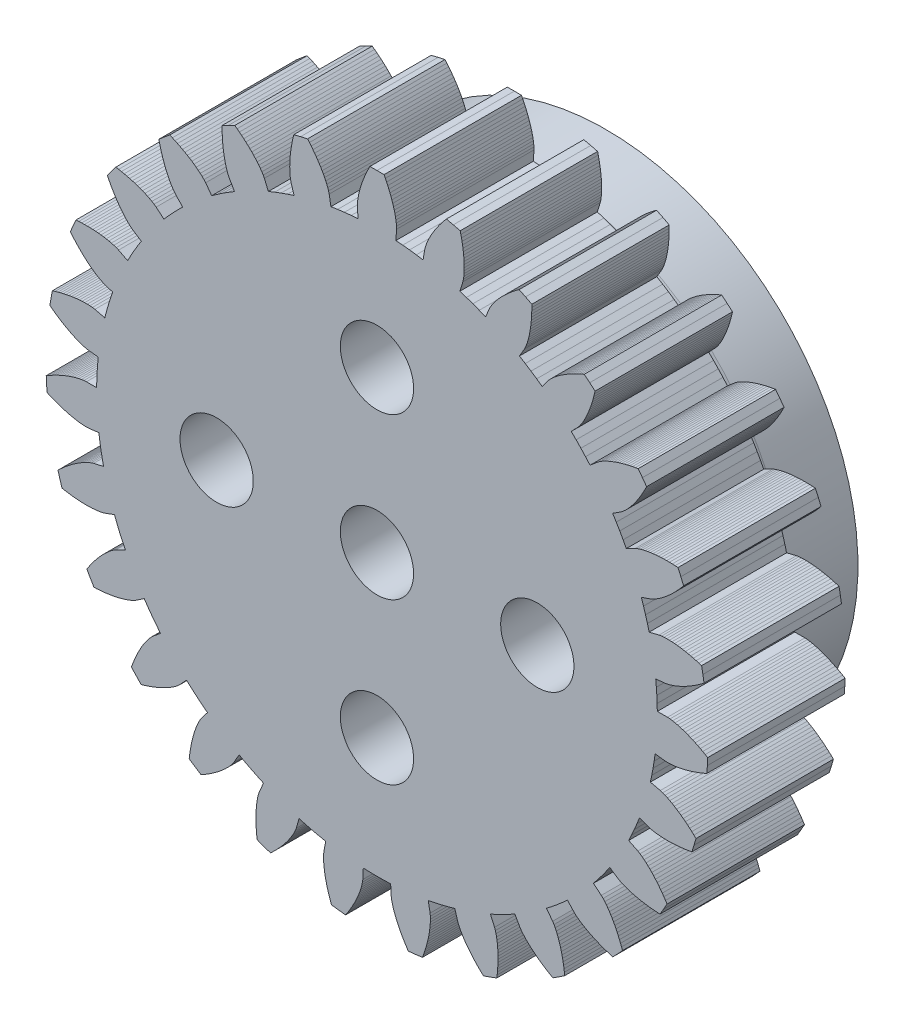
from build123d import *
from build123d.topology import SkipClean

# Parameters (mm, degrees)
MODULE_START                                 = 40.4
MODULE_1_27_TEETH_20_DEGREE_PRESSURE_A_DEPTH = 6
CUT_EXTRUDE_2_DEPTH                          = 10
CUT_EXTRUDE_2_DEPTH_BACK                     = 16
RETAINING_HEX_SOCKET_5_52_MM_ACROSS_FLAT_R   = 1.6
EXTRUDE_START                                = 4
SKETCH_1_R                                   = 11
SKETCH_1_R_2                                 = 1.6
EXTRUDE_1_DEPTH                              = 4
FILLET_1_R                                   = 1


with BuildPart() as part:
    # Module 1_ 27 teeth_ 20 degree pressu 2 → Module 1_ 27 teeth_ 20 degree pressure a (new body)
    with BuildSketch(Plane.XY.offset(MODULE_START)):
        Polygon((1.420977269, 12.157237499), (1.123771539, 12.188303308), (0.825896002, 12.212104479), (0.85597983, 12.656938746), (0.853703904, 12.767600163), (0.84324809, 12.878792473), (0.82733346, 12.990309278), (0.806902654, 13.102064381), (0.782486708, 13.213999352), (0.754435151, 13.326067971), (0.722998421, 13.438230654), (0.688365984, 13.550451883), (0.650686756, 13.662698822), (0.610081148, 13.774940507), (0.566648704, 13.887147335), (0.520473192, 13.999290719), (0.471626147, 14.111342854), (0.420169428, 14.223276544), (0.3661571, 14.33506508), (0.30963687, 14.446682145), (0, 14.45), (-0.30963687, 14.446682145), (-0.3661571, 14.33506508), (-0.420169428, 14.223276544), (-0.471626147, 14.111342854), (-0.520473192, 13.999290719), (-0.566648704, 13.887147335), (-0.610081148, 13.774940507), (-0.650686756, 13.662698822), (-0.688365984, 13.550451883), (-0.722998421, 13.438230654), (-0.754435151, 13.326067971), (-0.782486708, 13.213999352), (-0.806902654, 13.102064381), (-0.82733346, 12.990309278), (-0.84324809, 12.878792473), (-0.853703904, 12.767600163), (-0.85597983, 12.656938746), (-0.825896002, 12.212104479), (-1.123771539, 12.188303308), (-1.420977269, 12.157237499), (-1.717336049, 12.118925567), (-2.012671239, 12.073390348), (-2.085984167, 12.513171857), (-2.113719024, 12.620325517), (-2.149535712, 12.726109348), (-2.190738906, 12.830950037), (-2.236391498, 12.934981098), (-2.285963289, 13.038268143), (-2.339103514, 13.140846803), (-2.395559359, 13.242736318), (-2.45513827, 13.34394582), (-2.517687776, 13.4444777), (-2.583083568, 13.544329598), (-2.65122196, 13.643495666), (-2.722014849, 13.741967405), (-2.795386216, 13.839734256), (-2.871269599, 13.936784022), (-2.949606228, 14.033103184), (-3.030343614, 14.128677135), (-3.332399332, 14.06049838), (-3.63292475, 13.985862782), (-3.662180803, 13.864219907), (-3.688957011, 13.742988546), (-3.713213023, 13.622205307), (-3.734902389, 13.501908648), (-3.75397119, 13.382139297), (-3.770356231, 13.262940808), (-3.783982595, 13.144360314), (-3.79476025, 13.026449578), (-3.802579169, 12.909266498), (-3.807302023, 12.792877364), (-3.808752644, 12.677360436), (-3.806696474, 12.562811982), (-3.800804065, 12.449357584), (-3.790572169, 12.337176563), (-3.775103433, 12.226570179), (-3.751797733, 12.11836679), (-3.619938977, 11.692460896), (-3.904296312, 11.600606463), (-4.186326554, 11.501837678), (-4.465861606, 11.396213411), (-4.742734853, 11.283796618), (-4.915492217, 11.694816636), (-4.967190813, 11.792685856), (-5.026437487, 11.887358373), (-5.09070797, 11.979870957), (-5.159121204, 12.070569636), (-5.231176413, 12.159640523), (-5.306540504, 12.247199183), (-5.384971913, 12.33332264), (-5.466285384, 12.418064184), (-5.550333107, 12.501461305), (-5.63699358, 12.583540375), (-5.726164562, 12.664319614), (-5.817758365, 12.74381107), (-5.911698585, 12.822022002), (-6.007917738, 12.898955867), (-6.10635552, 12.974613063), (-6.20695749, 13.048991483), (-6.485148154, 12.912991653), (-6.760360717, 12.771061936), (-6.760775392, 12.645951051), (-6.758871968, 12.521812477), (-6.754619624, 12.398691145), (-6.747982031, 12.276635186), (-6.738916117, 12.155696666), (-6.727370434, 12.035932537), (-6.713282954, 11.91740594), (-6.696578009, 11.800188005), (-6.677161889, 11.684360442), (-6.654916257, 11.570019428), (-6.629687739, 11.457281737), (-6.601270302, 11.346295137), (-6.569372339, 11.2372578), (-6.533545521, 11.13046027), (-6.49298616, 11.026402632), (-6.445355248, 10.926490544), (-6.218830104, 10.54247372), (-6.47433946, 10.387517921), (-6.725989892, 10.226370812), (-6.973631407, 10.059128441), (-7.217116404, 9.885890492), (-7.48000481, 10.245990822), (-7.552880059, 10.329299448), (-7.632362716, 10.407756832), (-7.71623565, 10.482953934), (-7.803721351, 10.55543064), (-7.894375463, 10.625483535), (-7.987900522, 10.693301885), (-8.084079238, 10.759016345), (-8.182743639, 10.822721493), (-8.283758544, 10.884487895), (-8.387011809, 10.944369233), (-8.49240815, 11.002406813), (-8.599865022, 11.058632582), (-8.709309753, 11.113071222), (-8.820677476, 11.165741662), (-8.933909606, 11.216658193), (-9.048952681, 11.265831322), (-9.28828096, 11.069342203), (-9.523343888, 10.867769836), (-9.494894829, 10.7459357), (-9.464414387, 10.625582257), (-9.431882932, 10.506760334), (-9.397276215, 10.389525144), (-9.360564332, 10.273937281), (-9.321710355, 10.160064027), (-9.280668491, 10.047981126), (-9.237381513, 9.937775241), (-9.191777083, 9.829547491), (-9.143762233, 9.72341875), (-9.093214652, 9.619538014), (-9.039967939, 9.518096584), (-8.98378405, 9.41935454), (-8.924293743, 9.323697984), (-8.860830321, 9.231798865), (-8.791441994, 9.145564364), (-8.48246249, 8.824139057), (-8.695349292, 8.614435599), (-8.903053373, 8.399597648), (-9.105450934, 8.179753253), (-9.302421341, 7.955033451), (-9.641268407, 8.244800991), (-9.731391586, 8.309057833), (-9.826825295, 8.367070426), (-9.925779069, 8.420898151), (-10.027620861, 8.471245647), (-10.131986689, 8.51850398), (-10.238630755, 8.562925914), (-10.347371759, 8.604688694), (-10.458068066, 8.643923085), (-10.570604414, 8.680728925), (-10.68488406, 8.715184312), (-10.800823816, 8.747351413), (-10.91835073, 8.777280349), (-11.037399778, 8.805011897), (-11.157912209, 8.830579433), (-11.279834312, 8.854010377), (-11.40311649, 8.875327279), (-11.590680135, 8.62894165), (-11.772921124, 8.37859345), (-11.717142028, 8.266604173), (-11.659727777, 8.156524148), (-11.60067099, 8.048407355), (-11.539960807, 7.942313112), (-11.477582101, 7.838307278), (-11.413514459, 7.736463836), (-11.347730787, 7.636867049), (-11.28019539, 7.539614442), (-11.210861196, 7.444821091), (-11.13966562, 7.35262605), (-11.06652401, 7.263202507), (-10.991318565, 7.176774981), (-10.913877637, 7.093651438), (-10.833930979, 7.014292726), (-10.750984827, 6.939506432), (-10.663579827, 6.871598442), (-10.288803128, 6.630092774), (-10.447590593, 6.376946824), (-10.600150942, 6.12), (-10.746393245, 5.85940545), (-10.886230336, 5.595318497), (-11.282768729, 5.799131804), (-11.385281273, 5.84087276), (-11.49152118, 5.875313088), (-11.600221169, 5.904869568), (-11.710928734, 5.930373608), (-11.823379889, 5.95228967), (-11.937393754, 5.970920391), (-12.052834789, 5.986480049), (-12.169595337, 5.999128546), (-12.287586264, 6.008989612), (-12.406731447, 6.01616155), (-12.526964276, 6.020724035), (-12.648225323, 6.022742661), (-12.770460724, 6.022272101), (-12.893621007, 6.019358382), (-13.017660231, 6.01404057), (-13.142535338, 6.006352045), (-13.268222744, 5.723352619), (-13.387817136, 5.437724923), (-13.307715068, 5.341617876), (-13.226462224, 5.24774571), (-13.144063873, 5.156162651), (-13.060523124, 5.066928925), (-12.975840448, 4.9801121), (-12.890013043, 4.895788877), (-12.80303398, 4.814047493), (-12.714891013, 4.734991077), (-12.62556488, 4.658742458), (-12.53502675, 4.585451377), (-12.443234193, 4.515305873), (-12.350124362, 4.448551581), (-12.255601256, 4.385527751), (-12.159508192, 4.326745131), (-12.061550958, 4.273103411), (-11.960841311, 4.22718287), (-11.540471726, 4.078616473), (-11.636599581, 3.795675195), (-11.725791631, 3.510471568), (-11.807994714, 3.223175582), (-11.883159835, 2.933958475), (-12.316012068, 3.040829921), (-12.4253875, 3.057804724), (-12.536706183, 3.0668161), (-12.649292344, 3.070507939), (-12.762897407, 3.069793593), (-12.877371619, 3.065185884), (-12.992608765, 3.057021005), (-13.108526377, 3.045538715), (-13.225056573, 3.030919434), (-13.342141158, 3.013304114), (-13.459728729, 2.992805961), (-13.577772848, 2.969517865), (-13.696230816, 2.943517357), (-13.815062827, 2.914870057), (-13.934231358, 2.883632162), (-14.053700718, 2.849852279), (-14.173436704, 2.813572818), (-14.230472031, 2.509216167), (-14.28097246, 2.203707238), (-14.180865744, 2.128663577), (-14.080154669, 2.056059942), (-13.978856869, 1.985947885), (-13.876989259, 1.918385287), (-13.774567878, 1.85343779), (-13.671607688, 1.791180672), (-13.568122296, 1.731701391), (-13.46412357, 1.675103118), (-13.359621093, 1.621509814), (-13.254621344, 1.571073832), (-13.149126401, 1.52398793), (-13.043131758, 1.480505614), (-12.936622239, 1.440979128), (-12.829563171, 1.405941587), (-12.721875755, 1.376336278), (-12.613290744, 1.354878775), (-12.169990507, 1.307260902), (-12.198276474, 1.009777735), (-12.219291857, 0.711692706), (-12.233024132, 0.413183484), (-12.239465112, 0.114427992), (-12.685296009, 0.11859611), (-12.795637871, 0.109889645), (-12.906034111, 0.092986263), (-13.016436893, 0.070614432), (-13.126814978, 0.04372021), (-13.237140912, 0.012837133), (-13.347388876, -0.021683176), (-13.457533915, -0.0595884), (-13.567551586, -0.100687328), (-13.677417768, -0.144829389), (-13.787108552, -0.191892572), (-13.896600172, -0.241775782), (-14.00586896, -0.29439373), (-14.114891317, -0.349673385), (-14.223643691, -0.407551414), (-14.332102561, -0.467972287), (-14.440244428, -0.530886848), (-14.425552887, -0.840192778), (-14.404236863, -1.149112875), (-14.289522277, -1.199047526), (-14.174782332, -1.246468549), (-14.060046074, -1.291329847), (-13.945343311, -1.333578998), (-13.830704788, -1.37315583), (-13.716162424, -1.409990546), (-13.601749628, -1.444001182), (-13.487501741, -1.475090084), (-13.373456675, -1.503138844), (-13.25965587, -1.528000709), (-13.1461458, -1.549488596), (-13.032980545, -1.567354794), (-12.920226568, -1.581253053), (-12.807973079, -1.590656633), (-12.696360936, -1.594629499), (-12.585754408, -1.590467185), (-12.143421949, -1.534569443), (-12.102341124, -1.830557106), (-12.054046897, -2.125453695), (-11.998568052, -2.419083442), (-11.935937657, -2.711271334), (-12.370712359, -2.810031249), (-12.476072093, -2.843949614), (-12.579594399, -2.885856488), (-12.681861961, -2.933085917), (-12.783062556, -2.98471014), (-12.883292512, -3.040203671), (-12.982607796, -3.099218411), (-13.081042315, -3.161503089), (-13.178616381, -3.226866011), (-13.275341246, -3.295155102), (-13.371221784, -3.366246127), (-13.466258183, -3.440035233), (-13.560447083, -3.516433975), (-13.653782363, -3.595365846), (-13.74625571, -3.676763788), (-13.837857045, -3.760568345), (-13.928574838, -3.846726267), (-13.842948453, -4.144306713), (-13.750965128, -4.439984015), (-13.627826965, -4.462117668), (-13.50524381, -4.481799598), (-13.383254555, -4.498991651), (-13.261900295, -4.513649693), (-13.141224823, -4.525722265), (-13.021275293, -4.535148809), (-12.902103116, -4.541857277), (-12.783765202, -4.545760798), (-12.666325747, -4.546752898), (-12.549858916, -4.544700336), (-12.434453077, -4.539431791), (-12.320217977, -4.530718699), (-12.207298139, -4.518239473), (-12.095901842, -4.501502141), (-11.986382014, -4.479628387), (-11.879716794, -4.450070648), (-11.46219837, -4.293670751), (-11.353965432, -4.572206138), (-11.238965148, -4.848016336), (-11.117266063, -5.120936954), (-10.988940713, -5.39080532), (-11.389220403, -5.587169095), (-11.483918038, -5.644470814), (-11.574985497, -5.709121969), (-11.663604568, -5.778662845), (-11.750171923, -5.852233994), (-11.834902478, -5.929346309), (-11.917930971, -6.009673979), (-11.999348339, -6.092980328), (-12.079218556, -6.179083512), (-12.157587642, -6.267838151), (-12.234488989, -6.359124481), (-12.309946731, -6.452841495), (-12.383977994, -6.548902353), (-12.456594467, -6.647231202), (-12.527803526, -6.747760874), (-12.597609074, -6.85043119), (-12.666012173, -6.955187677), (-12.514067085, -7.225), (-12.356375303, -7.491494468), (-12.231451974, -7.48463389), (-12.107634098, -7.47551567), (-11.98496832, -7.464111652), (-11.863504802, -7.450388366), (-11.743298026, -7.434305841), (-11.624407841, -7.415816026), (-11.506900886, -7.394860671), (-11.390852571, -7.371368371), (-11.276349918, -7.345250327), (-11.163495819, -7.316393992), (-11.05241577, -7.284653043), (-10.943269269, -7.249830387), (-10.836271108, -7.211646433), (-10.731737407, -7.169670504), (-10.630214134, -7.123129349), (-10.533240573, -7.069769651), (-10.163044711, -6.821299158), (-9.993494525, -7.067366354), (-9.817987879, -7.309221162), (-9.636629383, -7.546719429), (-9.449527131, -7.779719596), (-9.793732627, -8.063101209), (-9.87266299, -8.14069713), (-9.946366131, -8.224607206), (-10.016559233, -8.312710564), (-10.083826479, -8.404262399), (-10.148489788, -8.498836352), (-10.210755402, -8.596146467), (-10.270766388, -8.69598342), (-10.328626932, -8.798185021), (-10.384415341, -8.902620422), (-10.438191725, -9.009180789), (-10.490002863, -9.117773401), (-10.539885446, -9.228317711), (-10.587868339, -9.340742605), (-10.633974211, -9.454984425), (-10.678220737, -9.570985517), (-10.720621513, -9.68869312), (-10.510549121, -9.916191667), (-10.295650088, -10.139136515), (-10.175676242, -10.103651563), (-10.057298699, -10.066224758), (-9.940569339, -10.026839461), (-9.825544694, -9.985474673), (-9.712286993, -9.942104064), (-9.600865553, -9.896694681), (-9.491358651, -9.849205212), (-9.383856131, -9.799583567), (-9.278463147, -9.747763409), (-9.175305774, -9.693658954), (-9.074539868, -9.637156764), (-8.976366082, -9.578101842), (-8.881057896, -9.516271667), (-8.78902223, -9.451320075), (-8.70096866, -9.382620564), (-8.618914626, -9.308335541), (-8.31599868, -8.981189562), (-8.094271741, -9.181523021), (-7.867720343, -9.376383984), (-7.636479518, -9.565656306), (-7.400687096, -9.749227175), (-7.67026219, -10.10434945), (-7.729170124, -10.198056357), (-7.781535592, -10.296701741), (-7.829518598, -10.398617904), (-7.873859341, -10.503214842), (-7.914969387, -10.610151927), (-7.953115366, -10.719198474), (-7.988484762, -10.830183795), (-8.021216357, -10.942974099), (-8.051416521, -11.057460123), (-8.079168844, -11.173549829), (-8.104540226, -11.291163783), (-8.127584945, -11.410232073), (-8.148347489, -11.530692155), (-8.166864594, -11.652487318), (-8.183166757, -11.775565537), (-8.197279373, -11.899878608), (-7.940404733, -12.072798875), (-7.679883711, -12.240175088), (-7.571327169, -12.177978764), (-7.464771723, -12.114261064), (-7.360271693, -12.04901776), (-7.257886929, -11.982241456), (-7.157684055, -11.913920884), (-7.059738118, -11.844039965), (-6.964134814, -11.772576551), (-6.870973577, -11.699500676), (-6.780372026, -11.624772042), (-6.692472619, -11.548336252), (-6.607453173, -11.47011887), (-6.525544676, -11.390015347), (-6.447064554, -11.307872232), (-6.372488589, -11.223446533), (-6.302651712, -11.136292277), (-6.239940761, -11.045086653), (-6.020635008, -10.656901712), (-5.758684672, -10.800701405), (-5.493301966, -10.938063518), (-5.224645066, -11.068906176), (-4.952874103, -11.193151394), (-5.133285933, -11.600869597), (-5.168995696, -11.705635727), (-5.197200455, -11.813698419), (-5.220386588, -11.923933062), (-5.239410407, -12.035936254), (-5.254750937, -12.149471466), (-5.266720822, -12.264375717), (-5.275541856, -12.380526159), (-5.281379931, -12.49782461), (-5.284363752, -12.616189286), (-5.284595879, -12.735549905), (-5.282159728, -12.855844604), (-5.277124236, -12.97701787), (-5.269547116, -13.099019107), (-5.259477193, -13.221801604), (-5.246956138, -13.345321771), (-5.23201978, -13.46953856), (-4.942191071, -13.57855837), (-4.650092816, -13.681342653), (-4.558805889, -13.595787978), (-4.469816972, -13.50921442), (-4.383179895, -13.421630392), (-4.298954601, -13.333042501), (-4.217208516, -13.243455146), (-4.138018374, -13.152869988), (-4.061472667, -13.06128524), (-3.987675059, -12.968694676), (-3.916749293, -12.875086206), (-3.848846533, -12.780439755), (-3.784156967, -12.684723898), (-3.722929468, -12.587890177), (-3.665508294, -12.489862479), (-3.61241244, -12.390514084), (-3.564557179, -12.28960359), (-3.524570074, -12.186394285), (-3.400697345, -11.758097532), (-3.112645422, -11.837611181), (-2.822738258, -11.910069216), (-2.531148647, -11.975428449), (-2.238050386, -12.033649923), (-2.319572903, -12.471983861), (-2.330159372, -12.582161244), (-2.332682897, -12.693815558), (-2.329822186, -12.806425902), (-2.322503502, -12.919797228), (-2.311247505, -13.033809853), (-2.296395995, -13.148377291), (-2.278193122, -13.263431153), (-2.256822947, -13.378914162), (-2.232429566, -13.494776419), (-2.205128983, -13.610973189), (-2.175016632, -13.727463514), (-2.142172394, -13.844209274), (-2.106664094, -13.961174548), (-2.068550015, -14.078325143), (-2.027880756, -14.195628254), (-1.984700646, -14.313052202), (-1.677542609, -14.352294269), (-1.369614214, -14.384945495), (-1.300518203, -14.280644743), (-1.23389323, -14.17588253), (-1.169789734, -14.070679456), (-1.108264517, -13.965055773), (-1.049382175, -13.859031312), (-0.993216988, -13.752625386), (-0.939855477, -13.645856662), (-0.889399947, -13.538742988), (-0.841973593, -13.43130114), (-0.797728134, -13.323546441), (-0.756855879, -13.215492178), (-0.719610169, -13.107148589), (-0.686343532, -12.998521006), (-0.6575902, -12.889605814), (-0.634296446, -12.780379192), (-0.619188902, -12.670730247), (-0.597427207, -12.225411271), (-0.298802652, -12.236352274), (0, -12.24), (0.298802652, -12.236352274), (0.597427207, -12.225411271), (0.619188902, -12.670730247), (0.634296446, -12.780379192), (0.6575902, -12.889605814), (0.686343532, -12.998521006), (0.719610169, -13.107148589), (0.756855879, -13.215492178), (0.797728134, -13.323546441), (0.841973593, -13.43130114), (0.889399947, -13.538742988), (0.939855477, -13.645856662), (0.993216988, -13.752625386), (1.049382175, -13.859031312), (1.108264517, -13.965055773), (1.169789734, -14.070679456), (1.23389323, -14.17588253), (1.300518203, -14.280644743), (1.369614214, -14.384945495), (1.677542609, -14.352294269), (1.984700646, -14.313052202), (2.027880756, -14.195628254), (2.068550015, -14.078325143), (2.106664094, -13.961174548), (2.142172394, -13.844209274), (2.175016632, -13.727463514), (2.205128983, -13.610973189), (2.232429566, -13.494776419), (2.256822947, -13.378914162), (2.278193122, -13.263431153), (2.296395995, -13.148377291), (2.311247505, -13.033809853), (2.322503502, -12.919797228), (2.329822186, -12.806425902), (2.332682897, -12.693815558), (2.330159372, -12.582161244), (2.319572903, -12.471983861), (2.238050386, -12.033649923), (2.531148647, -11.975428449), (2.822738258, -11.910069216), (3.112645422, -11.837611181), (3.400697345, -11.758097532), (3.524570074, -12.186394285), (3.564557179, -12.28960359), (3.61241244, -12.390514084), (3.665508294, -12.489862479), (3.722929468, -12.587890177), (3.784156967, -12.684723898), (3.848846533, -12.780439755), (3.916749293, -12.875086206), (3.987675059, -12.968694676), (4.061472667, -13.06128524), (4.138018374, -13.152869988), (4.217208516, -13.243455146), (4.298954601, -13.333042501), (4.383179895, -13.421630392), (4.469816972, -13.50921442), (4.558805889, -13.595787978), (4.650092816, -13.681342653), (4.942191071, -13.57855837), (5.23201978, -13.46953856), (5.246956138, -13.345321771), (5.259477193, -13.221801604), (5.269547116, -13.099019107), (5.277124236, -12.97701787), (5.282159728, -12.855844604), (5.284595879, -12.735549905), (5.284363752, -12.616189286), (5.281379931, -12.49782461), (5.275541856, -12.380526159), (5.266720822, -12.264375717), (5.254750937, -12.149471466), (5.239410407, -12.035936254), (5.220386588, -11.923933062), (5.197200455, -11.813698419), (5.168995696, -11.705635727), (5.133285933, -11.600869597), (4.952874103, -11.193151394), (5.224645066, -11.068906176), (5.493301966, -10.938063518), (5.758684672, -10.800701405), (6.020635008, -10.656901712), (6.239940761, -11.045086653), (6.302651712, -11.136292277), (6.372488589, -11.223446533), (6.447064554, -11.307872232), (6.525544676, -11.390015347), (6.607453173, -11.47011887), (6.692472619, -11.548336252), (6.780372026, -11.624772042), (6.870973577, -11.699500676), (6.964134814, -11.772576551), (7.059738118, -11.844039965), (7.157684055, -11.913920884), (7.257886929, -11.982241456), (7.360271693, -12.04901776), (7.464771723, -12.114261064), (7.571327169, -12.177978764), (7.679883711, -12.240175088), (7.940404733, -12.072798875), (8.197279373, -11.899878608), (8.183166757, -11.775565537), (8.166864594, -11.652487318), (8.148347489, -11.530692155), (8.127584945, -11.410232073), (8.104540226, -11.291163783), (8.079168844, -11.173549829), (8.051416521, -11.057460123), (8.021216357, -10.942974099), (7.988484762, -10.830183795), (7.953115366, -10.719198474), (7.914969387, -10.610151927), (7.873859341, -10.503214842), (7.829518598, -10.398617904), (7.781535592, -10.296701741), (7.729170124, -10.198056357), (7.67026219, -10.10434945), (7.400687096, -9.749227175), (7.636479518, -9.565656306), (7.867720343, -9.376383984), (8.094271741, -9.181523021), (8.31599868, -8.981189562), (8.618914626, -9.308335541), (8.70096866, -9.382620564), (8.78902223, -9.451320075), (8.881057896, -9.516271667), (8.976366082, -9.578101842), (9.074539868, -9.637156764), (9.175305774, -9.693658954), (9.278463147, -9.747763409), (9.383856131, -9.799583567), (9.491358651, -9.849205212), (9.600865553, -9.896694681), (9.712286993, -9.942104064), (9.825544694, -9.985474673), (9.940569339, -10.026839461), (10.057298699, -10.066224758), (10.175676242, -10.103651563), (10.295650088, -10.139136515), (10.510549121, -9.916191667), (10.720621513, -9.68869312), (10.678220737, -9.570985517), (10.633974211, -9.454984425), (10.587868339, -9.340742605), (10.539885446, -9.228317711), (10.490002863, -9.117773401), (10.438191725, -9.009180789), (10.384415341, -8.902620422), (10.328626932, -8.798185021), (10.270766388, -8.69598342), (10.210755402, -8.596146467), (10.148489788, -8.498836352), (10.083826479, -8.404262399), (10.016559233, -8.312710564), (9.946366131, -8.224607206), (9.87266299, -8.14069713), (9.793732627, -8.063101209), (9.449527131, -7.779719596), (9.636629383, -7.546719429), (9.817987879, -7.309221162), (9.993494525, -7.067366354), (10.163044711, -6.821299158), (10.533240573, -7.069769651), (10.630214134, -7.123129349), (10.731737407, -7.169670504), (10.836271108, -7.211646433), (10.943269269, -7.249830387), (11.05241577, -7.284653043), (11.163495819, -7.316393992), (11.276349918, -7.345250327), (11.390852571, -7.371368371), (11.506900886, -7.394860671), (11.624407841, -7.415816026), (11.743298026, -7.434305841), (11.863504802, -7.450388366), (11.98496832, -7.464111652), (12.107634098, -7.47551567), (12.231451974, -7.48463389), (12.356375303, -7.491494468), (12.514067085, -7.225), (12.666012173, -6.955187677), (12.597609074, -6.85043119), (12.527803526, -6.747760874), (12.456594467, -6.647231202), (12.383977994, -6.548902353), (12.309946731, -6.452841495), (12.234488989, -6.359124481), (12.157587642, -6.267838151), (12.079218556, -6.179083512), (11.999348339, -6.092980328), (11.917930971, -6.009673979), (11.834902478, -5.929346309), (11.750171923, -5.852233994), (11.663604568, -5.778662845), (11.574985497, -5.709121969), (11.483918038, -5.644470814), (11.389220403, -5.587169095), (10.988940713, -5.39080532), (11.117266063, -5.120936954), (11.238965148, -4.848016336), (11.353965432, -4.572206138), (11.46219837, -4.293670751), (11.879716794, -4.450070648), (11.986382014, -4.479628387), (12.095901842, -4.501502141), (12.207298139, -4.518239473), (12.320217977, -4.530718699), (12.434453077, -4.539431791), (12.549858916, -4.544700336), (12.666325747, -4.546752898), (12.783765202, -4.545760798), (12.902103116, -4.541857277), (13.021275293, -4.535148809), (13.141224823, -4.525722265), (13.261900295, -4.513649693), (13.383254555, -4.498991651), (13.50524381, -4.481799598), (13.627826965, -4.462117668), (13.750965128, -4.439984015), (13.842948453, -4.144306713), (13.928574838, -3.846726267), (13.837857045, -3.760568345), (13.74625571, -3.676763788), (13.653782363, -3.595365846), (13.560447083, -3.516433975), (13.466258183, -3.440035233), (13.371221784, -3.366246127), (13.275341246, -3.295155102), (13.178616381, -3.226866011), (13.081042315, -3.161503089), (12.982607796, -3.099218411), (12.883292512, -3.040203671), (12.783062556, -2.98471014), (12.681861961, -2.933085917), (12.579594399, -2.885856488), (12.476072093, -2.843949614), (12.370712359, -2.810031249), (11.935937657, -2.711271334), (11.998568052, -2.419083442), (12.054046897, -2.125453695), (12.102341124, -1.830557106), (12.143421949, -1.534569443), (12.585754408, -1.590467185), (12.696360936, -1.594629499), (12.807973079, -1.590656633), (12.920226568, -1.581253053), (13.032980545, -1.567354794), (13.1461458, -1.549488596), (13.25965587, -1.528000709), (13.373456675, -1.503138844), (13.487501741, -1.475090084), (13.601749628, -1.444001182), (13.716162424, -1.409990546), (13.830704788, -1.37315583), (13.945343311, -1.333578998), (14.060046074, -1.291329847), (14.174782332, -1.246468549), (14.289522277, -1.199047526), (14.404236863, -1.149112875), (14.425552887, -0.840192778), (14.440244428, -0.530886848), (14.332102561, -0.467972287), (14.223643691, -0.407551414), (14.114891317, -0.349673385), (14.00586896, -0.29439373), (13.896600172, -0.241775782), (13.787108552, -0.191892572), (13.677417768, -0.144829389), (13.567551586, -0.100687328), (13.457533915, -0.0595884), (13.347388876, -0.021683176), (13.237140912, 0.012837133), (13.126814978, 0.04372021), (13.016436893, 0.070614432), (12.906034111, 0.092986263), (12.795637871, 0.109889645), (12.685296009, 0.11859611), (12.239465112, 0.114427992), (12.233024132, 0.413183484), (12.219291857, 0.711692706), (12.198276474, 1.009777735), (12.169990507, 1.307260902), (12.613290744, 1.354878775), (12.721875755, 1.376336278), (12.829563171, 1.405941587), (12.936622239, 1.440979128), (13.043131758, 1.480505614), (13.149126401, 1.52398793), (13.254621344, 1.571073832), (13.359621093, 1.621509814), (13.46412357, 1.675103118), (13.568122296, 1.731701391), (13.671607688, 1.791180672), (13.774567878, 1.85343779), (13.876989259, 1.918385287), (13.978856869, 1.985947885), (14.080154669, 2.056059942), (14.180865744, 2.128663577), (14.28097246, 2.203707238), (14.230472031, 2.509216167), (14.173436704, 2.813572818), (14.053700718, 2.849852279), (13.934231358, 2.883632162), (13.815062827, 2.914870057), (13.696230816, 2.943517357), (13.577772848, 2.969517865), (13.459728729, 2.992805961), (13.342141158, 3.013304114), (13.225056573, 3.030919434), (13.108526377, 3.045538715), (12.992608765, 3.057021005), (12.877371619, 3.065185884), (12.762897407, 3.069793593), (12.649292344, 3.070507939), (12.536706183, 3.0668161), (12.4253875, 3.057804724), (12.316012068, 3.040829921), (11.883159835, 2.933958475), (11.807994714, 3.223175582), (11.725791631, 3.510471568), (11.636599581, 3.795675195), (11.540471726, 4.078616473), (11.960841311, 4.22718287), (12.061550958, 4.273103411), (12.159508192, 4.326745131), (12.255601256, 4.385527751), (12.350124362, 4.448551581), (12.443234193, 4.515305873), (12.53502675, 4.585451377), (12.62556488, 4.658742458), (12.714891013, 4.734991077), (12.80303398, 4.814047493), (12.890013043, 4.895788877), (12.975840448, 4.9801121), (13.060523124, 5.066928925), (13.144063873, 5.156162651), (13.226462224, 5.24774571), (13.307715068, 5.341617876), (13.387817136, 5.437724923), (13.268222744, 5.723352619), (13.142535338, 6.006352045), (13.017660231, 6.01404057), (12.893621007, 6.019358382), (12.770460724, 6.022272101), (12.648225323, 6.022742661), (12.526964276, 6.020724035), (12.406731447, 6.01616155), (12.287586264, 6.008989612), (12.169595337, 5.999128546), (12.052834789, 5.986480049), (11.937393754, 5.970920391), (11.823379889, 5.95228967), (11.710928734, 5.930373608), (11.600221169, 5.904869568), (11.49152118, 5.875313088), (11.385281273, 5.84087276), (11.282768729, 5.799131804), (10.886230336, 5.595318497), (10.746393245, 5.85940545), (10.600150942, 6.12), (10.447590593, 6.376946824), (10.288803128, 6.630092774), (10.663579827, 6.871598442), (10.750984827, 6.939506432), (10.833930979, 7.014292726), (10.913877637, 7.093651438), (10.991318565, 7.176774981), (11.06652401, 7.263202507), (11.13966562, 7.35262605), (11.210861196, 7.444821091), (11.28019539, 7.539614442), (11.347730787, 7.636867049), (11.413514459, 7.736463836), (11.477582101, 7.838307278), (11.539960807, 7.942313112), (11.60067099, 8.048407355), (11.659727777, 8.156524148), (11.717142028, 8.266604173), (11.772921124, 8.37859345), (11.590680135, 8.62894165), (11.40311649, 8.875327279), (11.279834312, 8.854010377), (11.157912209, 8.830579433), (11.037399778, 8.805011897), (10.91835073, 8.777280349), (10.800823816, 8.747351413), (10.68488406, 8.715184312), (10.570604414, 8.680728925), (10.458068066, 8.643923085), (10.347371759, 8.604688694), (10.238630755, 8.562925914), (10.131986689, 8.51850398), (10.027620861, 8.471245647), (9.925779069, 8.420898151), (9.826825295, 8.367070426), (9.731391586, 8.309057833), (9.641268407, 8.244800991), (9.302421341, 7.955033451), (9.105450934, 8.179753253), (8.903053373, 8.399597648), (8.695349292, 8.614435599), (8.48246249, 8.824139057), (8.791441994, 9.145564364), (8.860830321, 9.231798865), (8.924293743, 9.323697984), (8.98378405, 9.41935454), (9.039967939, 9.518096584), (9.093214652, 9.619538014), (9.143762233, 9.72341875), (9.191777083, 9.829547491), (9.237381513, 9.937775241), (9.280668491, 10.047981126), (9.321710355, 10.160064027), (9.360564332, 10.273937281), (9.397276215, 10.389525144), (9.431882932, 10.506760334), (9.464414387, 10.625582257), (9.494894829, 10.7459357), (9.523343888, 10.867769836), (9.28828096, 11.069342203), (9.048952681, 11.265831322), (8.933909606, 11.216658193), (8.820677476, 11.165741662), (8.709309753, 11.113071222), (8.599865022, 11.058632582), (8.49240815, 11.002406813), (8.387011809, 10.944369233), (8.283758544, 10.884487895), (8.182743639, 10.822721493), (8.084079238, 10.759016345), (7.987900522, 10.693301885), (7.894375463, 10.625483535), (7.803721351, 10.55543064), (7.71623565, 10.482953934), (7.632362716, 10.407756832), (7.552880059, 10.329299448), (7.48000481, 10.245990822), (7.217116404, 9.885890492), (6.973631407, 10.059128441), (6.725989892, 10.226370812), (6.47433946, 10.387517921), (6.218830104, 10.54247372), (6.445355248, 10.926490544), (6.49298616, 11.026402632), (6.533545521, 11.13046027), (6.569372339, 11.2372578), (6.601270302, 11.346295137), (6.629687739, 11.457281737), (6.654916257, 11.570019428), (6.677161889, 11.684360442), (6.696578009, 11.800188005), (6.713282954, 11.91740594), (6.727370434, 12.035932537), (6.738916117, 12.155696666), (6.747982031, 12.276635186), (6.754619624, 12.398691145), (6.758871968, 12.521812477), (6.760775392, 12.645951051), (6.760360717, 12.771061936), (6.485148154, 12.912991653), (6.20695749, 13.048991483), (6.10635552, 12.974613063), (6.007917738, 12.898955867), (5.911698585, 12.822022002), (5.817758365, 12.74381107), (5.726164562, 12.664319614), (5.63699358, 12.583540375), (5.550333107, 12.501461305), (5.466285384, 12.418064184), (5.384971913, 12.33332264), (5.306540504, 12.247199183), (5.231176413, 12.159640523), (5.159121204, 12.070569636), (5.09070797, 11.979870957), (5.026437487, 11.887358373), (4.967190813, 11.792685856), (4.915492217, 11.694816636), (4.742734853, 11.283796618), (4.465861606, 11.396213411), (4.186326554, 11.501837678), (3.904296312, 11.600606463), (3.619938977, 11.692460896), (3.751797733, 12.11836679), (3.775103433, 12.226570179), (3.790572169, 12.337176563), (3.800804065, 12.449357584), (3.806696474, 12.562811982), (3.808752644, 12.677360436), (3.807302023, 12.792877364), (3.802579169, 12.909266498), (3.79476025, 13.026449578), (3.783982595, 13.144360314), (3.770356231, 13.262940808), (3.75397119, 13.382139297), (3.734902389, 13.501908648), (3.713213023, 13.622205307), (3.688957011, 13.742988546), (3.662180803, 13.864219907), (3.63292475, 13.985862782), (3.332399332, 14.06049838), (3.030343614, 14.128677135), (2.949606228, 14.033103184), (2.871269599, 13.936784022), (2.795386216, 13.839734256), (2.722014849, 13.741967405), (2.65122196, 13.643495666), (2.583083568, 13.544329598), (2.517687776, 13.4444777), (2.45513827, 13.34394582), (2.395559359, 13.242736318), (2.339103514, 13.140846803), (2.285963289, 13.038268143), (2.236391498, 12.934981098), (2.190738906, 12.830950037), (2.149535712, 12.726109348), (2.113719024, 12.620325517), (2.085984167, 12.513171857), (2.012671239, 12.073390348), (1.717336049, 12.118925567), align=None)
    extrude(amount=MODULE_1_27_TEETH_20_DEGREE_PRESSURE_A_DEPTH)

    # Retaining hex socket 5.52 mm across flats profile → 切除-拉伸2 (cut, two sides: drawn at the far end of the back side and taken through both)
    with BuildSketch(Plane.XY.offset(40.4).offset(-CUT_EXTRUDE_2_DEPTH_BACK)):
        Circle(RETAINING_HEX_SOCKET_5_52_MM_ACROSS_FLAT_R)
        with Locations((0, 7)):
            Circle(RETAINING_HEX_SOCKET_5_52_MM_ACROSS_FLAT_R)
        with Locations((7, 0)):
            Circle(RETAINING_HEX_SOCKET_5_52_MM_ACROSS_FLAT_R)
        with Locations((0, -7)):
            Circle(RETAINING_HEX_SOCKET_5_52_MM_ACROSS_FLAT_R)
        with Locations((-7, 0)):
            Circle(RETAINING_HEX_SOCKET_5_52_MM_ACROSS_FLAT_R)
    extrude(amount=CUT_EXTRUDE_2_DEPTH + CUT_EXTRUDE_2_DEPTH_BACK, mode=Mode.SUBTRACT)

    # 草图1 → 凸台-拉伸1 (add)
    with SkipClean():  # the faces are left unmerged after this step: merging them gives an invalid solid
        with BuildSketch(Plane(origin=(0, 0, 40.4), x_dir=(-1, 0, 0), z_dir=(0, 0, -1)).offset(EXTRUDE_START)):
            Circle(SKETCH_1_R)
            with Locations((0, 7)):
                Circle(SKETCH_1_R_2, mode=Mode.SUBTRACT)
            with Locations((7, 0)):
                Circle(SKETCH_1_R_2, mode=Mode.SUBTRACT)
            Circle(SKETCH_1_R_2, mode=Mode.SUBTRACT)
            with Locations((0, -7)):
                Circle(SKETCH_1_R_2, mode=Mode.SUBTRACT)
            with Locations((-7, 0)):
                Circle(SKETCH_1_R_2, mode=Mode.SUBTRACT)
        extrude(amount=-EXTRUDE_1_DEPTH)

    # 圆角1
    fillet_1_edges = [part.edges().sort_by_distance(p)[0] for p in [
        (11, 0, 40.4),
    ]]
    fillet(fillet_1_edges, radius=FILLET_1_R)


solid = part.part
